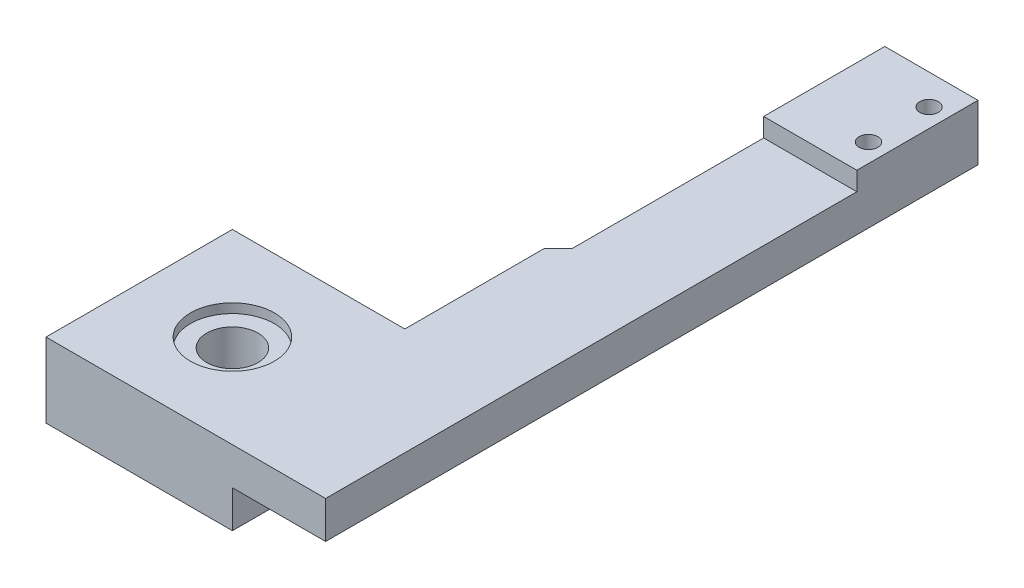
from build123d import *

# Parameters (mm, degrees)
SKETCH1_W                       = 30
SKETCH1_H                       = 20
BOSS_EXTRUDE1_DEPTH             = 4
SKETCH2_W                       = 20
SKETCH2_H                       = 20
BOSS_EXTRUDE2_DEPTH             = 4
CBORE_FOR_M5_SBHCS1_D           = 5.5
CBORE_FOR_M5_SBHCS1_CBORE_D     = 9
CBORE_FOR_M5_SBHCS1_CBORE_DEPTH = 1
SKETCH10_W                      = 10
SKETCH10_H                      = 4
BOSS_EXTRUDE3_DEPTH             = 50
BOSS_EXTRUDE4_DEPTH             = 15
SKETCH11_W                      = 10
SKETCH11_H                      = 13
BOSS_EXTRUDE5_DEPTH             = 2
SKETCH12_R                      = 1
CUT_EXTRUDE1_DEPTH              = 4
CHAMFER1_SIZE                   = 1.5


with BuildPart() as part:
    # Sketch1 → Boss-Extrude1 (new body)
    with BuildSketch(Plane(origin=(0, 0, 0), x_dir=(1, 0, 0), z_dir=(0, 1, 0))):
        with Locations((15, 10)):
            Rectangle(SKETCH1_W, SKETCH1_H)
    extrude(amount=BOSS_EXTRUDE1_DEPTH)

    # Sketch2 → Boss-Extrude2 (add)
    with BuildSketch(Plane.XZ):
        with Locations((10, -10)):
            Rectangle(SKETCH2_W, SKETCH2_H)
    extrude(amount=BOSS_EXTRUDE2_DEPTH)

    # CBORE for M5 SBHCS1 (through all)
    with Locations(Plane(origin=(0, 4, 0), x_dir=(1, 0, 0), z_dir=(0, 1, 0))):
        with Locations((10, 10)):
            CounterBoreHole(CBORE_FOR_M5_SBHCS1_D / 2, CBORE_FOR_M5_SBHCS1_CBORE_D / 2, CBORE_FOR_M5_SBHCS1_CBORE_DEPTH)

    # Sketch10 → Boss-Extrude3 (add)
    with BuildSketch(Plane(origin=(0, 0, -20), x_dir=(-1, 0, 0), z_dir=(0, 0, -1))):
        with Locations((-25, 2)):
            Rectangle(SKETCH10_W, SKETCH10_H)
    extrude(amount=BOSS_EXTRUDE3_DEPTH)

    # Sketch10<3> → Boss-Extrude4 (add)
    with BuildSketch(Plane(origin=(0, 0, -20), x_dir=(-1, 0, 0), z_dir=(0, 0, -1))):
        Polygon((-18.5, 4), (-20, 4), (-20, 0), (-20, -1.5), (-18.5, -1.5), align=None)
    extrude(amount=BOSS_EXTRUDE4_DEPTH)

    # Sketch11 → Boss-Extrude5 (add)
    with BuildSketch(Plane(origin=(0, 4, 0), x_dir=(1, 0, 0), z_dir=(0, 1, 0))):
        with Locations((25, 63.5)):
            Rectangle(SKETCH11_W, SKETCH11_H)
    extrude(amount=BOSS_EXTRUDE5_DEPTH)

    # Sketch12 → Cut-Extrude1 (cut)
    with BuildSketch(Plane(origin=(0, 6, 0), x_dir=(1, 0, 0), z_dir=(0, 1, 0))):
        with Locations(Location((28, 60.25, 0), (0, 0, 270))):
            Circle(SKETCH12_R)
        with Locations(Location((28, 66.75, 0), (0, 0, 270))):
            Circle(SKETCH12_R)
    extrude(amount=-CUT_EXTRUDE1_DEPTH, mode=Mode.SUBTRACT)

    # Chamfer1
    chamfer1_edges = [part.edges().sort_by_distance(p)[0] for p in [
        (20, 2, -35),
    ]]
    chamfer(chamfer1_edges, length=CHAMFER1_SIZE - 0.0001)  # a hair under: the kernel refuses the full size


solid = part.part
